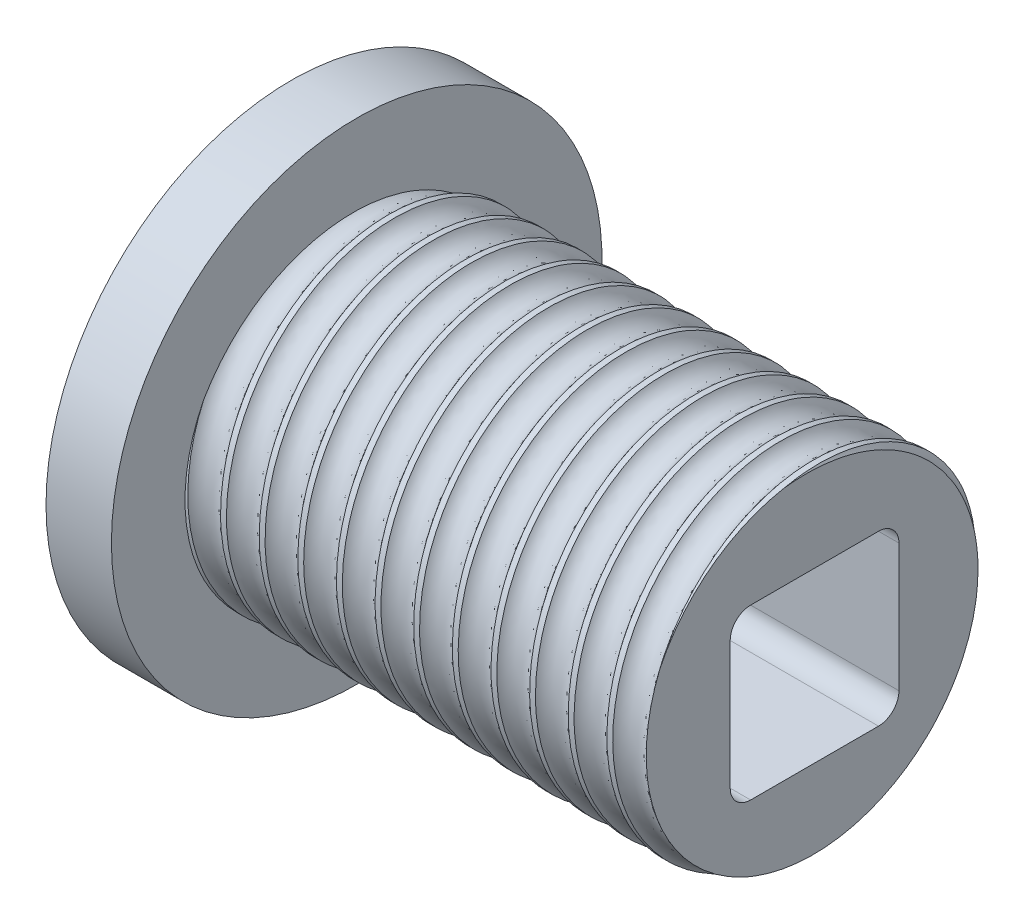
from build123d import *

# Parameters (mm, degrees)
SKETCH1_R           = 6.6675
BOSS_EXTRUDE1_DEPTH = 17.78
CUT_SWEEP3_PITCH    = 1.5
SKETCH5_R           = 9.525
BOSS_EXTRUDE2_DEPTH = 2.54
SKETCH6_W           = 6.5532
SKETCH6_H           = 6.5532
CUT_EXTRUDE1_DEPTH  = 25.379369513
FILLET1_R           = 0.79375


with BuildPart() as part:
    # Sketch1 → Boss-Extrude1 (new body)
    with BuildSketch(Plane(origin=(0, 0, 0), x_dir=(0, 0, -1), z_dir=(1, 0, 0))):
        Circle(SKETCH1_R)
    extrude(amount=BOSS_EXTRUDE1_DEPTH)

    # Cut-Sweep3: arcs per turn and ends read off the stored shape
    # Cut-Sweep3: the profile of Sketch3 profile screwed along a right-hand helix through 13.7 turns, 8 arcs to a turn; built about Z, then put on its axis
    cut_sweep3_z = Axis((0, 0, 0), (0, 0, 1))
    cut_sweep3_corners = [(6.6678, -0.022771542, -0.864019111), (6.6678, 0.022771542, -2.135980889), (6.6675, 0.022771542, -2.135980889), (6.314375, 0, -1.5), (6.6675, -0.022771542, -0.864019111)]
    with BuildLine(mode=Mode.PRIVATE) as cut_sweep3_profile:
        Line(cut_sweep3_corners[0], cut_sweep3_corners[1])
        Line(cut_sweep3_corners[4], cut_sweep3_corners[0])
        Line(cut_sweep3_corners[2], cut_sweep3_corners[1])
        ThreePointArc((6.6675, 0.022771542, -2.135980889), (6.408571581, 0.01302117, -1.863665126), (6.314375, 0, -1.5))
        ThreePointArc((6.314375, 0, -1.5), (6.408571581, -0.01302117, -1.136334874), (6.6675, -0.022771542, -0.864019111))
    cut_sweep3_cap = Face(cut_sweep3_profile.wire())
    cut_sweep3_arcs = [((6.6675, 0.022771542, -2.135980889), (6.314375, 0.014891471, -1.915900309), (6.314375, 0, -1.5), (1, 0.8744045593049781, 1)), ((6.314375, 0, -1.5), (6.314375, -0.014891471, -1.084099691), (6.6675, -0.022771542, -0.864019111), (1, 0.8744045593049781, 1))]  # start, shoulder, end, weights
    cut_sweep3_turn_angles = [0, 22.5, 45, 67.5, 90, 112.5, 135, 157.5, 180, 202.5, 225, 247.5, 270, 292.5, 315, 337.5, 360]
    cut_sweep3_turn_weights = [1, 0.9238795325112867, 1, 0.9238795325112867, 1, 0.9238795325112867, 1, 0.9238795325112867, 1, 0.9238795325112867, 1, 0.9238795325112867, 1, 0.9238795325112867, 1, 0.9238795325112867, 1]
    cut_sweep3_turn_rails = [Edge.make_bspline([Vector(p[0], p[1], 0).rotate(cut_sweep3_z, cut_sweep3_turn_angles[k]) / cut_sweep3_turn_weights[k] + Vector(0, 0, p[2] + CUT_SWEEP3_PITCH * cut_sweep3_turn_angles[k] / 360) for k in range(17)], [0, 0, 0, 1, 1, 2, 2, 3, 3, 4, 4, 5, 5, 6, 6, 7, 7, 8, 8, 8], 2, cut_sweep3_turn_weights) for p in cut_sweep3_corners]
    cut_sweep3_turn_sides = [*[Face.make_surface_from_curves(cut_sweep3_turn_rails[p[0]], cut_sweep3_turn_rails[p[1]]) for p in [(0, 1), (4, 0), (2, 1)]], *[Face.make_bezier_surface([[Vector(p[j][0], p[j][1], 0).rotate(cut_sweep3_z, cut_sweep3_turn_angles[2 * i + k]) / cut_sweep3_turn_weights[2 * i + k] + Vector(0, 0, p[j][2] + CUT_SWEEP3_PITCH * cut_sweep3_turn_angles[2 * i + k] / 360) for k in range(3)] for j in range(3)], [[p[3][j] * cut_sweep3_turn_weights[2 * i + k] for k in range(3)] for j in range(3)]) for p in cut_sweep3_arcs for i in range(8)]]
    cut_sweep3_last_angles = [4680, 4702.5, 4725, 4747.5, 4770, 4792.5, 4815, 4837.5, 4860, 4882.5, 4905, 4918.5, 4932]
    cut_sweep3_last_weights = [1, 0.9238795325112867, 1, 0.9238795325112867, 1, 0.9238795325112867, 1, 0.9238795325112867, 1, 0.9238795325112867, 1, 0.9723699203976766, 1]
    cut_sweep3_last_rails = [Edge.make_bspline([Vector(p[0], p[1], 0).rotate(cut_sweep3_z, cut_sweep3_last_angles[k]) / cut_sweep3_last_weights[k] + Vector(0, 0, p[2] + CUT_SWEEP3_PITCH * cut_sweep3_last_angles[k] / 360) for k in range(13)], [0, 0, 0, 1, 1, 2, 2, 3, 3, 4, 4, 5, 5, 6, 6, 6], 2, cut_sweep3_last_weights) for p in cut_sweep3_corners]
    cut_sweep3_last_sides = [*[Face.make_surface_from_curves(cut_sweep3_last_rails[p[0]], cut_sweep3_last_rails[p[1]]) for p in [(0, 1), (4, 0), (2, 1)]], *[Face.make_bezier_surface([[Vector(p[j][0], p[j][1], 0).rotate(cut_sweep3_z, cut_sweep3_last_angles[2 * i + k]) / cut_sweep3_last_weights[2 * i + k] + Vector(0, 0, p[j][2] + CUT_SWEEP3_PITCH * cut_sweep3_last_angles[2 * i + k] / 360) for k in range(3)] for j in range(3)], [[p[3][j] * cut_sweep3_last_weights[2 * i + k] for k in range(3)] for j in range(3)]) for p in cut_sweep3_arcs for i in range(6)]]
    cut_sweep3 = Plane(origin=(0, 0, 0), x_dir=(0, 0, -1), z_dir=(1, 0, 0)) * Solid(Shell([*[p.moved(Location((0, 0, CUT_SWEEP3_PITCH * i))) for i in range(13) for p in cut_sweep3_turn_sides], *cut_sweep3_last_sides, cut_sweep3_cap, cut_sweep3_cap.rotate(cut_sweep3_z, 4932).moved(Location((0, 0, CUT_SWEEP3_PITCH * 4932 / 360)))]))
    add(cut_sweep3, mode=Mode.SUBTRACT)

    # Sketch5 → Boss-Extrude2 (add)
    with BuildSketch(Plane.ZY):
        Circle(SKETCH5_R)
    extrude(amount=BOSS_EXTRUDE2_DEPTH)

    # Sketch6 → Cut-Extrude1 (cut, through all)
    with BuildSketch(Plane.ZY.offset(2.54)):
        Rectangle(SKETCH6_W, SKETCH6_H)
    extrude(amount=-CUT_EXTRUDE1_DEPTH, mode=Mode.SUBTRACT)

    # Fillet1
    fillet1_edges = [part.edges().sort_by_distance(p)[0] for p in [
        (7.62, 3.2766, 3.2766),
        (7.62, -3.2766, 3.2766),
        (7.62, -3.2766, -3.2766),
        (7.62, 3.2766, -3.2766),
    ]]
    fillet(fillet1_edges, radius=FILLET1_R)


solid = part.part
